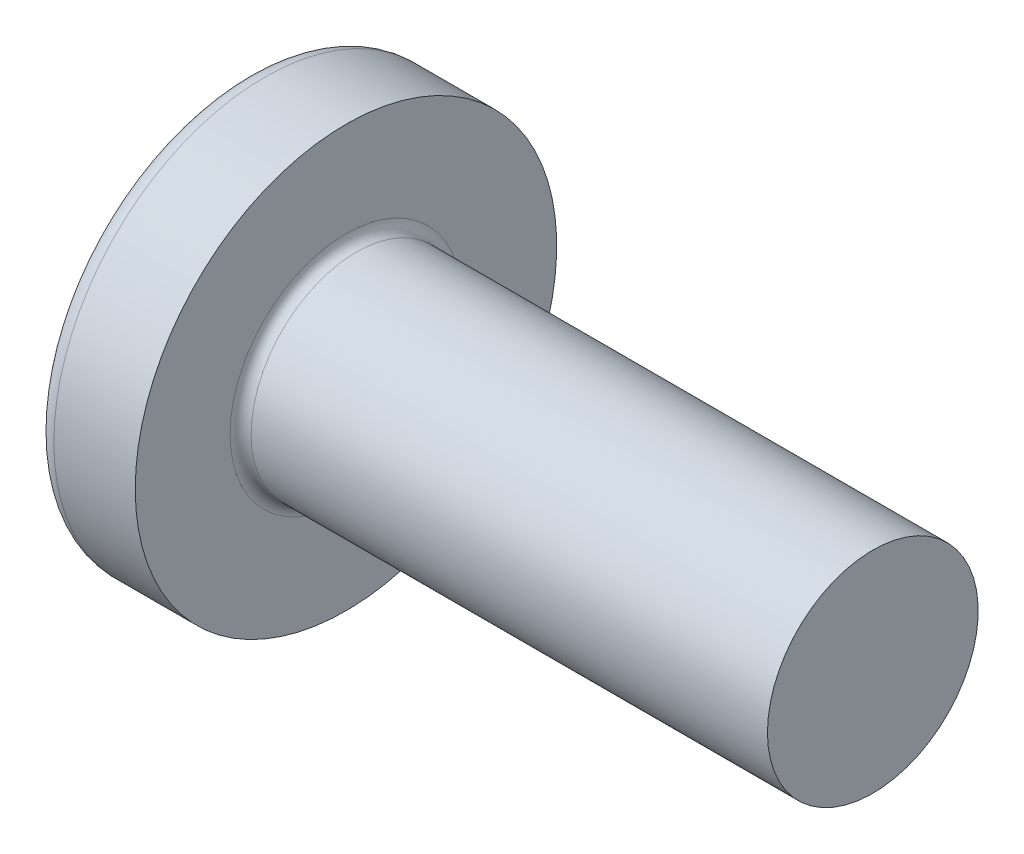
from build123d import *

# Parameters (mm, degrees)
RECPAT_COUNT = 2
RECPAT_ANGLE = 90


with BuildPart() as part:
    # Fillet1: read off the stored shape, not the designer's step
    # Fillet1 outline → Fillet1 (revolve)
    with BuildSketch(Plane.YX):
        with BuildLine():
            Line((2, 3.3), (2, 13.1))
            Line((2, 13.1), (0, 13.1))
            Line((0, 13.1), (0, 0))
            ThreePointArc((0, 0), (2.027933458, 0.324444488), (3.853420198, 1.265388956))
            ThreePointArc((3.853420198, 1.265388956), (3.961271902, 1.392873227), (4, 1.555305874))
            Line((4, 1.555305874), (4, 3.1))
            Line((4, 3.1), (2.2, 3.1))
            ThreePointArc((2.2, 3.1), (2.058578644, 3.158578644), (2, 3.3))
        make_face()
    revolve(axis=Axis((0, 0, 0), (1, 0, 0)))

    # Sketch3 → Recess section 0
    with BuildSketch(Plane(origin=(0, 0, 0), x_dir=(0, 0, -1), z_dir=(1, 0, 0))):
        with BuildLine():
            Line((0.515, -2.15), (-0.515, -2.15))
            Line((-0.515, -2.15), (-0.515, 2.15))
            Line((-0.515, 2.15), (0.515, 2.15))
            Line((0.515, 2.15), (0.515, -2.15))
        make_face()
    # Sketch4 → Recess section 1
    with BuildSketch(Plane(origin=(2.34, 0, 0), x_dir=(0, 0, -1), z_dir=(1, 0, 0))):
        with BuildLine():
            Line((0.515, -0.983319232), (-0.515, -0.983319232))
            Line((-0.515, -0.983319232), (-0.515, 0.983319232))
            Line((-0.515, 0.983319232), (0.515, 0.983319232))
            Line((0.515, 0.983319232), (0.515, -0.983319232))
        make_face()
    recess = loft(mode=Mode.SUBTRACT)

    # RecPat: Recess ×2 about axis
    recpat_axis = Axis((0, 0, 0), (1, 0, 0))
    for i in range(1, RECPAT_COUNT):
        add(recess.rotate(recpat_axis, i * RECPAT_ANGLE / (RECPAT_COUNT - 1)), mode=Mode.SUBTRACT)

    # RecCorSke → RecessCore (revolve, cut)
    with BuildSketch(Plane.XY, mode=Mode.PRIVATE) as recesscore_sk:
        Polygon((0, 0), (0, 1.01462874), (2.34, 0.851), (2.616506661, 0), align=None)
    revolve(recesscore_sk.sketch.rotate(Axis((-3.175, 0, 0), (1, 0, 0)), 90), axis=Axis((-3.175, 0, 0), (1, 0, 0)), mode=Mode.SUBTRACT)


solid = part.part
